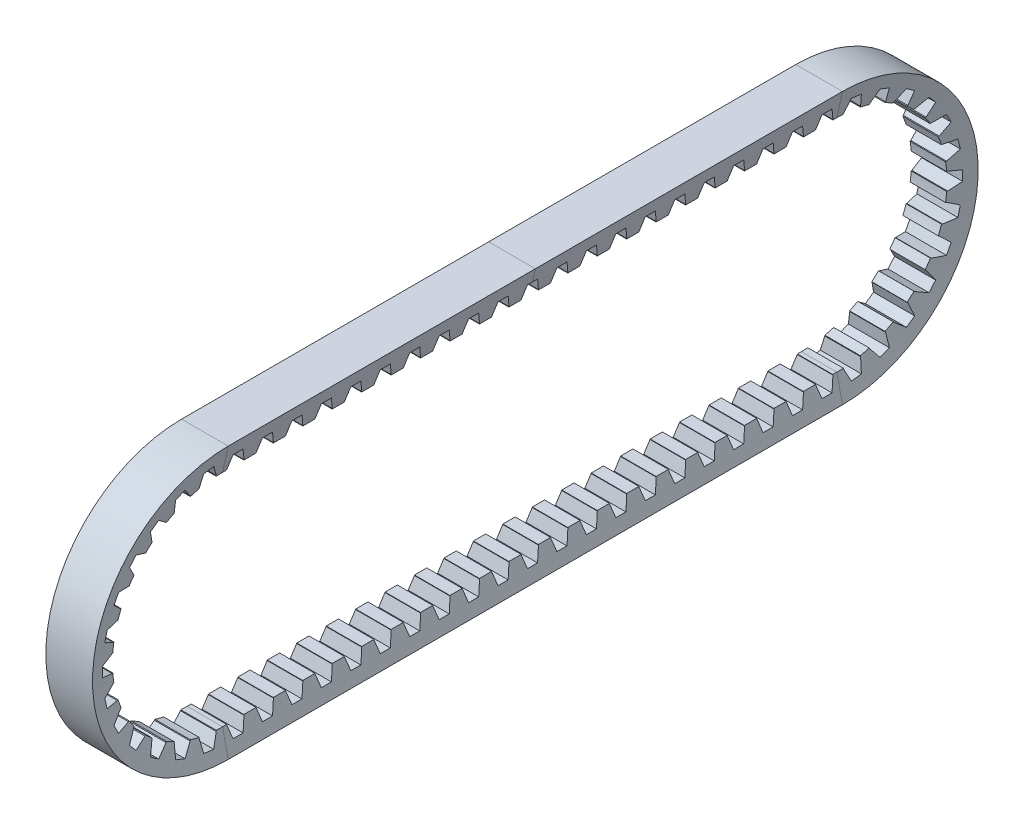
from build123d import *

# Parameters (mm, degrees)
TAGLIO_ESTRUSIONE4_DEPTH = 10
RIPETIZIONECURVA5_START  = -8.365940427
RIPETIZIONECURVA5_DEPTH  = 16.731876058


# Read off the part's stored shape, not the designer's step: RipetizioneCurva5
with BuildPart() as part:
    # Sweep1: sweep along a path in Schizzo2
    with BuildLine(Plane(origin=(0, 0, 0), x_dir=(0, 0, -1), z_dir=(1, 0, 0))) as sweep1_path:
        Line((-125, -5.1), (125, -5.1))
        ThreePointArc((125, -5.1), (175.133807074, -55.233807074), (125, -105.367614148))
        Line((125, -105.367614148), (-125, -105.367614148))
        ThreePointArc((-125, -105.367614148), (-175.133807074, -55.233807074), (-125, -5.1))
    # Schizzo1 → Sweep1 (sweep)
    with BuildSketch(Plane.XY):
        Polygon((-9.5, 0), (9.5, 0), (7.213146042, -10.401208291), (-7.213146042, -10.401208291), align=None)
    sweep(path=sweep1_path.line)

    # Schizzo4 → Taglio-Estrusione4 (cut, symmetric)
    with BuildSketch(Plane(origin=(0, 0, 0), x_dir=(0, 0, -1), z_dir=(1, 0, 0))):
        Polygon((2.05, -5.2), (3.5, -10.2), (3.5, -11.625591309), (-3.5, -11.625591309), (-3.5, -10.2), (-2.05, -5.2), align=None)
    extrude(amount=TAGLIO_ESTRUSIONE4_DEPTH, both=True, mode=Mode.SUBTRACT)

    # RipetizioneCurva5 outline → RipetizioneCurva5 (cut)
    with BuildSketch(Plane.YZ.offset(RIPETIZIONECURVA5_START)):
        Polygon((-10.2, 15.485294118), (-10.401208291, 15.485294118), (-10.401208291, 8.485294118), (-10.2, 8.485294118), (-5.2, 9.935294118), (-5.2, 14.035294118), align=None)
        Polygon((-10.2, 27.470588235), (-10.401208291, 27.470588235), (-10.401208291, 20.470588235), (-10.2, 20.470588235), (-5.2, 21.920588235), (-5.2, 26.020588235), align=None)
        Polygon((-10.2, 39.455882353), (-10.401208291, 39.455882353), (-10.401208291, 32.455882353), (-10.2, 32.455882353), (-5.2, 33.905882353), (-5.2, 38.005882353), align=None)
        Polygon((-10.2, 51.441176471), (-10.401208291, 51.441176471), (-10.401208291, 44.441176471), (-10.2, 44.441176471), (-5.2, 45.891176471), (-5.2, 49.991176471), align=None)
        Polygon((-10.2, 63.426470588), (-10.401208291, 63.426470588), (-10.401208291, 56.426470588), (-10.2, 56.426470588), (-5.2, 57.876470588), (-5.2, 61.976470588), align=None)
        Polygon((-10.2, 75.411764706), (-10.401208291, 75.411764706), (-10.401208291, 68.411764706), (-10.2, 68.411764706), (-5.2, 69.861764706), (-5.2, 73.961764706), align=None)
        Polygon((-10.2, 87.397058824), (-10.401208291, 87.397058824), (-10.401208291, 80.397058824), (-10.2, 80.397058824), (-5.2, 81.847058824), (-5.2, 85.947058824), align=None)
        Polygon((-10.2, 99.382352941), (-10.401208291, 99.382352941), (-10.401208291, 92.382352941), (-10.2, 92.382352941), (-5.2, 93.832352941), (-5.2, 97.932352941), align=None)
        Polygon((-10.2, 111.367647059), (-10.401208291, 111.367647059), (-10.401208291, 104.367647059), (-10.2, 104.367647059), (-5.2, 105.817647059), (-5.2, 109.917647059), align=None)
        Polygon((-10.2, 123.352941176), (-10.401208291, 123.352941176), (-10.401208291, 116.352941176), (-10.2, 116.352941176), (-5.2, 117.802941176), (-5.2, 121.902941176), align=None)
        with BuildLine():
            Line((-11.094194966, 134.591059512), (-11.429091704, 134.545094291))
            ThreePointArc((-11.429091704, 134.545094291), (-10.817614494, 131.096207868), (-10.477251833, 127.610110451))
            Line((-10.477251833, 127.610110451), (-10.142355095, 127.656075672))
            Line((-10.142355095, 127.656075672), (-5.38596204, 129.772493662))
            Line((-5.38596204, 129.772493662), (-5.94346825, 133.834412768))
            Line((-5.94346825, 133.834412768), (-11.094194966, 134.591059512))
        make_face()
        with BuildLine():
            Line((-14.620664595, 144.770342373), (-14.935152363, 144.646382418))
            ThreePointArc((-14.935152363, 144.646382418), (-13.524385413, 141.4403789), (-12.368210998, 138.13402401))
            Line((-12.368210998, 138.13402401), (-12.05372323, 138.257983966))
            Line((-12.05372323, 138.257983966), (-7.933762222, 141.440502039))
            Line((-7.933762222, 141.440502039), (-9.43725645, 145.254883392))
            Line((-9.43725645, 145.254883392), (-14.620664595, 144.770342373))
        make_face()
        with BuildLine():
            Line((-20.457247139, 153.825069968), (-20.733437583, 153.630166235))
            ThreePointArc((-20.733437583, 153.630166235), (-18.603626617, 150.849406053), (-16.697404712, 147.910862198))
            Line((-16.697404712, 147.910862198), (-16.421214268, 148.105765932))
            Line((-16.421214268, 148.105765932), (-13.17203248, 152.173359533))
            Line((-13.17203248, 152.173359533), (-15.53599459, 155.523237611))
            Line((-15.53599459, 155.523237611), (-20.457247139, 153.825069968))
        make_face()
        with BuildLine():
            Line((-28.271952413, 161.240201059), (-28.494135566, 160.985439851))
            ThreePointArc((-28.494135566, 160.985439851), (-25.766426191, 158.788095204), (-23.218584453, 156.384509462))
            Line((-23.218584453, 156.384509462), (-22.9964013, 156.63927067))
            Line((-22.9964013, 156.63927067), (-20.802815181, 161.360571332))
            Line((-20.802815181, 161.360571332), (-23.892780833, 164.055401988))
            Line((-23.892780833, 164.055401988), (-28.271952413, 161.240201059))
        make_face()
        with BuildLine():
            Line((-37.62027279, 166.593956167), (-37.775810671, 166.293828537))
            ThreePointArc((-37.775810671, 166.293828537), (-34.605357505, 164.804886409), (-31.560819516, 163.072976949))
            Line((-31.560819516, 163.072976949), (-31.405281636, 163.373104579))
            Line((-31.405281636, 163.373104579), (-30.392064383, 168.479560375))
            Line((-30.392064383, 168.479560375), (-34.032273488, 170.366059162))
            Line((-34.032273488, 170.366059162), (-37.62027279, 166.593956167))
        make_face()
        with BuildLine():
            Line((-47.970467204, 169.581808773), (-48.050512675, 169.253386257))
            ThreePointArc((-48.050512675, 169.253386257), (-44.617654012, 168.557539047), (-41.249595895, 167.595818473))
            Line((-41.249595895, 167.595818473), (-41.169550425, 167.924240989))
            Line((-41.169550425, 167.924240989), (-41.394334769, 173.125392015))
            Line((-41.394334769, 173.125392015), (-45.377728882, 174.096253146))
            Line((-45.377728882, 174.096253146), (-47.970467204, 169.581808773))
        make_face()
        with BuildLine():
            Line((-58.733807074, 170.033807074), (-58.733807074, 169.695770646))
            ThreePointArc((-58.733807074, 169.695770646), (-55.233807074, 169.832598783), (-51.733807074, 169.695770646))
            Line((-51.733807074, 169.695770646), (-51.733807074, 170.033807074))
            Line((-51.733807074, 170.033807074), (-53.183807074, 175.033807074))
            Line((-53.183807074, 175.033807074), (-57.283807074, 175.033807074))
            Line((-57.283807074, 175.033807074), (-58.733807074, 170.033807074))
        make_face()
        with BuildLine():
            Line((-69.298063723, 167.924240989), (-69.218018253, 167.595818473))
            ThreePointArc((-69.218018253, 167.595818473), (-65.849960136, 168.557539047), (-62.417101473, 169.253386257))
            Line((-62.417101473, 169.253386257), (-62.497146944, 169.581808773))
            Line((-62.497146944, 169.581808773), (-65.089885265, 174.096253146))
            Line((-65.089885265, 174.096253146), (-69.073279379, 173.125392015))
            Line((-69.073279379, 173.125392015), (-69.298063723, 167.924240989))
        make_face()
        with BuildLine():
            Line((-79.062332512, 163.373104579), (-78.906794632, 163.072976949))
            ThreePointArc((-78.906794632, 163.072976949), (-75.862256643, 164.804886409), (-72.691803477, 166.293828537))
            Line((-72.691803477, 166.293828537), (-72.847341358, 166.593956167))
            Line((-72.847341358, 166.593956167), (-76.43534066, 170.366059162))
            Line((-76.43534066, 170.366059162), (-80.075549765, 168.479560375))
            Line((-80.075549765, 168.479560375), (-79.062332512, 163.373104579))
        make_face()
        with BuildLine():
            Line((-87.471212848, 156.63927067), (-87.249029695, 156.384509462))
            ThreePointArc((-87.249029695, 156.384509462), (-84.701187957, 158.788095204), (-81.973478582, 160.985439851))
            Line((-81.973478582, 160.985439851), (-82.195661735, 161.240201059))
            Line((-82.195661735, 161.240201059), (-86.574833315, 164.055401988))
            Line((-86.574833315, 164.055401988), (-89.664798967, 161.360571332))
            Line((-89.664798967, 161.360571332), (-87.471212848, 156.63927067))
        make_face()
        with BuildLine():
            Line((-94.046399879, 148.105765932), (-93.770209436, 147.910862198))
            ThreePointArc((-93.770209436, 147.910862198), (-91.863987531, 150.849406053), (-89.734176565, 153.630166235))
            Line((-89.734176565, 153.630166235), (-90.010367009, 153.825069968))
            Line((-90.010367009, 153.825069968), (-94.931619558, 155.523237611))
            Line((-94.931619558, 155.523237611), (-97.295581668, 152.173359533))
            Line((-97.295581668, 152.173359533), (-94.046399879, 148.105765932))
        make_face()
        with BuildLine():
            Line((-98.413890918, 138.257983966), (-98.09940315, 138.13402401))
            ThreePointArc((-98.09940315, 138.13402401), (-96.943228735, 141.4403789), (-95.532461785, 144.646382418))
            Line((-95.532461785, 144.646382418), (-95.846949553, 144.770342373))
            Line((-95.846949553, 144.770342373), (-101.030357698, 145.254883392))
            Line((-101.030357698, 145.254883392), (-102.533851926, 141.440502039))
            Line((-102.533851926, 141.440502039), (-98.413890918, 138.257983966))
        make_face()
        with BuildLine():
            Line((-100.325259053, 127.656075672), (-99.990362315, 127.610110451))
            ThreePointArc((-99.990362315, 127.610110451), (-99.649999654, 131.096207868), (-99.038522444, 134.545094291))
            Line((-99.038522444, 134.545094291), (-99.373419182, 134.591059512))
            Line((-99.373419182, 134.591059512), (-104.524145898, 133.834412768))
            Line((-104.524145898, 133.834412768), (-105.081652108, 129.772493662))
            Line((-105.081652108, 129.772493662), (-100.325259053, 127.656075672))
        make_face()
        Polygon((-100.267614148, 116.352941176), (-100.066405857, 116.352941176), (-100.066405857, 123.352941176), (-100.267614148, 123.352941176), (-105.267614148, 121.902941176), (-105.267614148, 117.802941176), align=None)
        Polygon((-100.267614148, 104.367647059), (-100.066405857, 104.367647059), (-100.066405857, 111.367647059), (-100.267614148, 111.367647059), (-105.267614148, 109.917647059), (-105.267614148, 105.817647059), align=None)
        Polygon((-100.267614148, 92.382352941), (-100.066405857, 92.382352941), (-100.066405857, 99.382352941), (-100.267614148, 99.382352941), (-105.267614148, 97.932352941), (-105.267614148, 93.832352941), align=None)
        Polygon((-100.267614148, 80.397058824), (-100.066405857, 80.397058824), (-100.066405857, 87.397058824), (-100.267614148, 87.397058824), (-105.267614148, 85.947058824), (-105.267614148, 81.847058824), align=None)
        Polygon((-100.267614148, 68.411764706), (-100.066405857, 68.411764706), (-100.066405857, 75.411764706), (-100.267614148, 75.411764706), (-105.267614148, 73.961764706), (-105.267614148, 69.861764706), align=None)
        Polygon((-100.267614148, 56.426470588), (-100.066405857, 56.426470588), (-100.066405857, 63.426470588), (-100.267614148, 63.426470588), (-105.267614148, 61.976470588), (-105.267614148, 57.876470588), align=None)
        Polygon((-100.267614148, 44.441176471), (-100.066405857, 44.441176471), (-100.066405857, 51.441176471), (-100.267614148, 51.441176471), (-105.267614148, 49.991176471), (-105.267614148, 45.891176471), align=None)
        Polygon((-100.267614148, 32.455882353), (-100.066405857, 32.455882353), (-100.066405857, 39.455882353), (-100.267614148, 39.455882353), (-105.267614148, 38.005882353), (-105.267614148, 33.905882353), align=None)
        Polygon((-100.267614148, 20.470588235), (-100.066405857, 20.470588235), (-100.066405857, 27.470588235), (-100.267614148, 27.470588235), (-105.267614148, 26.020588235), (-105.267614148, 21.920588235), align=None)
        Polygon((-100.267614148, 8.485294118), (-100.066405857, 8.485294118), (-100.066405857, 15.485294118), (-100.267614148, 15.485294118), (-105.267614148, 14.035294118), (-105.267614148, 9.935294118), align=None)
        Polygon((-100.267614148, -3.5), (-100.066405857, -3.5), (-100.066405857, 3.5), (-100.267614148, 3.5), (-105.267614148, 2.05), (-105.267614148, -2.05), align=None)
        Polygon((-10.401208291, -8.485294118), (-10.401208291, -15.485294118), (-10.2, -15.485294118), (-5.2, -14.035294118), (-5.2, -9.935294118), (-10.2, -8.485294118), align=None)
        Polygon((-10.401208291, -20.470588235), (-10.401208291, -27.470588235), (-10.2, -27.470588235), (-5.2, -26.020588235), (-5.2, -21.920588235), (-10.2, -20.470588235), align=None)
        Polygon((-10.401208291, -32.455882353), (-10.401208291, -39.455882353), (-10.2, -39.455882353), (-5.2, -38.005882353), (-5.2, -33.905882353), (-10.2, -32.455882353), align=None)
        Polygon((-10.401208291, -44.441176471), (-10.401208291, -51.441176471), (-10.2, -51.441176471), (-5.2, -49.991176471), (-5.2, -45.891176471), (-10.2, -44.441176471), align=None)
        Polygon((-10.401208291, -56.426470588), (-10.401208291, -63.426470588), (-10.2, -63.426470588), (-5.2, -61.976470588), (-5.2, -57.876470588), (-10.2, -56.426470588), align=None)
        Polygon((-10.401208291, -68.411764706), (-10.401208291, -75.411764706), (-10.2, -75.411764706), (-5.2, -73.961764706), (-5.2, -69.861764706), (-10.2, -68.411764706), align=None)
        Polygon((-10.401208291, -80.397058824), (-10.401208291, -87.397058824), (-10.2, -87.397058824), (-5.2, -85.947058824), (-5.2, -81.847058824), (-10.2, -80.397058824), align=None)
        Polygon((-10.401208291, -92.382352941), (-10.401208291, -99.382352941), (-10.2, -99.382352941), (-5.2, -97.932352941), (-5.2, -93.832352941), (-10.2, -92.382352941), align=None)
        Polygon((-10.401208291, -104.367647059), (-10.401208291, -111.367647059), (-10.2, -111.367647059), (-5.2, -109.917647059), (-5.2, -105.817647059), (-10.2, -104.367647059), align=None)
        Polygon((-10.401208291, -116.352941176), (-10.401208291, -123.352941176), (-10.2, -123.352941176), (-5.2, -121.902941176), (-5.2, -117.802941176), (-10.2, -116.352941176), align=None)
        with BuildLine():
            ThreePointArc((-10.477251833, -127.610110451), (-10.817614494, -131.096207868), (-11.429091704, -134.545094291))
            Line((-11.429091704, -134.545094291), (-11.094194966, -134.591059512))
            Line((-11.094194966, -134.591059512), (-5.94346825, -133.834412768))
            Line((-5.94346825, -133.834412768), (-5.38596204, -129.772493662))
            Line((-5.38596204, -129.772493662), (-10.142355095, -127.656075672))
            Line((-10.142355095, -127.656075672), (-10.477251833, -127.610110451))
        make_face()
        with BuildLine():
            ThreePointArc((-12.368210998, -138.13402401), (-13.524385413, -141.4403789), (-14.935152363, -144.646382418))
            Line((-14.935152363, -144.646382418), (-14.620664595, -144.770342373))
            Line((-14.620664595, -144.770342373), (-9.43725645, -145.254883392))
            Line((-9.43725645, -145.254883392), (-7.933762222, -141.440502039))
            Line((-7.933762222, -141.440502039), (-12.05372323, -138.257983966))
            Line((-12.05372323, -138.257983966), (-12.368210998, -138.13402401))
        make_face()
        with BuildLine():
            ThreePointArc((-16.697404712, -147.910862198), (-18.603626617, -150.849406053), (-20.733437583, -153.630166235))
            Line((-20.733437583, -153.630166235), (-20.457247139, -153.825069968))
            Line((-20.457247139, -153.825069968), (-15.53599459, -155.523237611))
            Line((-15.53599459, -155.523237611), (-13.17203248, -152.173359533))
            Line((-13.17203248, -152.173359533), (-16.421214268, -148.105765932))
            Line((-16.421214268, -148.105765932), (-16.697404712, -147.910862198))
        make_face()
        with BuildLine():
            ThreePointArc((-23.218584453, -156.384509462), (-25.766426191, -158.788095204), (-28.494135566, -160.985439851))
            Line((-28.494135566, -160.985439851), (-28.271952413, -161.240201059))
            Line((-28.271952413, -161.240201059), (-23.892780833, -164.055401988))
            Line((-23.892780833, -164.055401988), (-20.802815181, -161.360571332))
            Line((-20.802815181, -161.360571332), (-22.9964013, -156.63927067))
            Line((-22.9964013, -156.63927067), (-23.218584453, -156.384509462))
        make_face()
        with BuildLine():
            ThreePointArc((-31.560819516, -163.072976949), (-34.605357505, -164.804886409), (-37.775810671, -166.293828537))
            Line((-37.775810671, -166.293828537), (-37.62027279, -166.593956167))
            Line((-37.62027279, -166.593956167), (-34.032273488, -170.366059162))
            Line((-34.032273488, -170.366059162), (-30.392064383, -168.479560375))
            Line((-30.392064383, -168.479560375), (-31.405281636, -163.373104579))
            Line((-31.405281636, -163.373104579), (-31.560819516, -163.072976949))
        make_face()
        with BuildLine():
            ThreePointArc((-41.249595895, -167.595818473), (-44.617654012, -168.557539047), (-48.050512675, -169.253386257))
            Line((-48.050512675, -169.253386257), (-47.970467204, -169.581808773))
            Line((-47.970467204, -169.581808773), (-45.377728882, -174.096253146))
            Line((-45.377728882, -174.096253146), (-41.394334769, -173.125392015))
            Line((-41.394334769, -173.125392015), (-41.169550425, -167.924240989))
            Line((-41.169550425, -167.924240989), (-41.249595895, -167.595818473))
        make_face()
        with BuildLine():
            ThreePointArc((-51.733807074, -169.695770646), (-55.233807074, -169.832598783), (-58.733807074, -169.695770646))
            Line((-58.733807074, -169.695770646), (-58.733807074, -170.033807074))
            Line((-58.733807074, -170.033807074), (-57.283807074, -175.033807074))
            Line((-57.283807074, -175.033807074), (-53.183807074, -175.033807074))
            Line((-53.183807074, -175.033807074), (-51.733807074, -170.033807074))
            Line((-51.733807074, -170.033807074), (-51.733807074, -169.695770646))
        make_face()
        with BuildLine():
            ThreePointArc((-62.417101473, -169.253386257), (-65.849960136, -168.557539047), (-69.218018253, -167.595818473))
            Line((-69.218018253, -167.595818473), (-69.298063723, -167.924240989))
            Line((-69.298063723, -167.924240989), (-69.073279379, -173.125392015))
            Line((-69.073279379, -173.125392015), (-65.089885265, -174.096253146))
            Line((-65.089885265, -174.096253146), (-62.497146944, -169.581808773))
            Line((-62.497146944, -169.581808773), (-62.417101473, -169.253386257))
        make_face()
        with BuildLine():
            ThreePointArc((-72.691803477, -166.293828537), (-75.862256643, -164.804886409), (-78.906794632, -163.072976949))
            Line((-78.906794632, -163.072976949), (-79.062332512, -163.373104579))
            Line((-79.062332512, -163.373104579), (-80.075549765, -168.479560375))
            Line((-80.075549765, -168.479560375), (-76.43534066, -170.366059162))
            Line((-76.43534066, -170.366059162), (-72.847341358, -166.593956167))
            Line((-72.847341358, -166.593956167), (-72.691803477, -166.293828537))
        make_face()
        with BuildLine():
            ThreePointArc((-81.973478582, -160.985439851), (-84.701187957, -158.788095204), (-87.249029695, -156.384509462))
            Line((-87.249029695, -156.384509462), (-87.471212848, -156.63927067))
            Line((-87.471212848, -156.63927067), (-89.664798967, -161.360571332))
            Line((-89.664798967, -161.360571332), (-86.574833315, -164.055401988))
            Line((-86.574833315, -164.055401988), (-82.195661735, -161.240201059))
            Line((-82.195661735, -161.240201059), (-81.973478582, -160.985439851))
        make_face()
        with BuildLine():
            ThreePointArc((-89.734176565, -153.630166235), (-91.863987531, -150.849406053), (-93.770209436, -147.910862198))
            Line((-93.770209436, -147.910862198), (-94.046399879, -148.105765932))
            Line((-94.046399879, -148.105765932), (-97.295581668, -152.173359533))
            Line((-97.295581668, -152.173359533), (-94.931619558, -155.523237611))
            Line((-94.931619558, -155.523237611), (-90.010367009, -153.825069968))
            Line((-90.010367009, -153.825069968), (-89.734176565, -153.630166235))
        make_face()
        with BuildLine():
            ThreePointArc((-95.532461785, -144.646382418), (-96.943228735, -141.4403789), (-98.09940315, -138.13402401))
            Line((-98.09940315, -138.13402401), (-98.413890918, -138.257983966))
            Line((-98.413890918, -138.257983966), (-102.533851926, -141.440502039))
            Line((-102.533851926, -141.440502039), (-101.030357698, -145.254883392))
            Line((-101.030357698, -145.254883392), (-95.846949553, -144.770342373))
            Line((-95.846949553, -144.770342373), (-95.532461785, -144.646382418))
        make_face()
        with BuildLine():
            ThreePointArc((-99.038522444, -134.545094291), (-99.649999654, -131.096207868), (-99.990362315, -127.610110451))
            Line((-99.990362315, -127.610110451), (-100.325259053, -127.656075672))
            Line((-100.325259053, -127.656075672), (-105.081652108, -129.772493662))
            Line((-105.081652108, -129.772493662), (-104.524145898, -133.834412768))
            Line((-104.524145898, -133.834412768), (-99.373419182, -134.591059512))
            Line((-99.373419182, -134.591059512), (-99.038522444, -134.545094291))
        make_face()
        Polygon((-100.066405857, -123.352941176), (-100.066405857, -116.352941176), (-100.267614148, -116.352941176), (-105.267614148, -117.802941176), (-105.267614148, -121.902941176), (-100.267614148, -123.352941176), align=None)
        Polygon((-100.066405857, -111.367647059), (-100.066405857, -104.367647059), (-100.267614148, -104.367647059), (-105.267614148, -105.817647059), (-105.267614148, -109.917647059), (-100.267614148, -111.367647059), align=None)
        Polygon((-100.066405857, -99.382352941), (-100.066405857, -92.382352941), (-100.267614148, -92.382352941), (-105.267614148, -93.832352941), (-105.267614148, -97.932352941), (-100.267614148, -99.382352941), align=None)
        Polygon((-100.066405857, -87.397058824), (-100.066405857, -80.397058824), (-100.267614148, -80.397058824), (-105.267614148, -81.847058824), (-105.267614148, -85.947058824), (-100.267614148, -87.397058824), align=None)
        Polygon((-100.066405857, -75.411764706), (-100.066405857, -68.411764706), (-100.267614148, -68.411764706), (-105.267614148, -69.861764706), (-105.267614148, -73.961764706), (-100.267614148, -75.411764706), align=None)
        Polygon((-100.066405857, -63.426470588), (-100.066405857, -56.426470588), (-100.267614148, -56.426470588), (-105.267614148, -57.876470588), (-105.267614148, -61.976470588), (-100.267614148, -63.426470588), align=None)
        Polygon((-100.066405857, -51.441176471), (-100.066405857, -44.441176471), (-100.267614148, -44.441176471), (-105.267614148, -45.891176471), (-105.267614148, -49.991176471), (-100.267614148, -51.441176471), align=None)
        Polygon((-100.066405857, -39.455882353), (-100.066405857, -32.455882353), (-100.267614148, -32.455882353), (-105.267614148, -33.905882353), (-105.267614148, -38.005882353), (-100.267614148, -39.455882353), align=None)
        Polygon((-100.066405857, -27.470588235), (-100.066405857, -20.470588235), (-100.267614148, -20.470588235), (-105.267614148, -21.920588235), (-105.267614148, -26.020588235), (-100.267614148, -27.470588235), align=None)
        Polygon((-100.066405857, -15.485294118), (-100.066405857, -8.485294118), (-100.267614148, -8.485294118), (-105.267614148, -9.935294118), (-105.267614148, -14.035294118), (-100.267614148, -15.485294118), align=None)
    extrude(amount=RIPETIZIONECURVA5_DEPTH, mode=Mode.SUBTRACT)


solid = part.part
